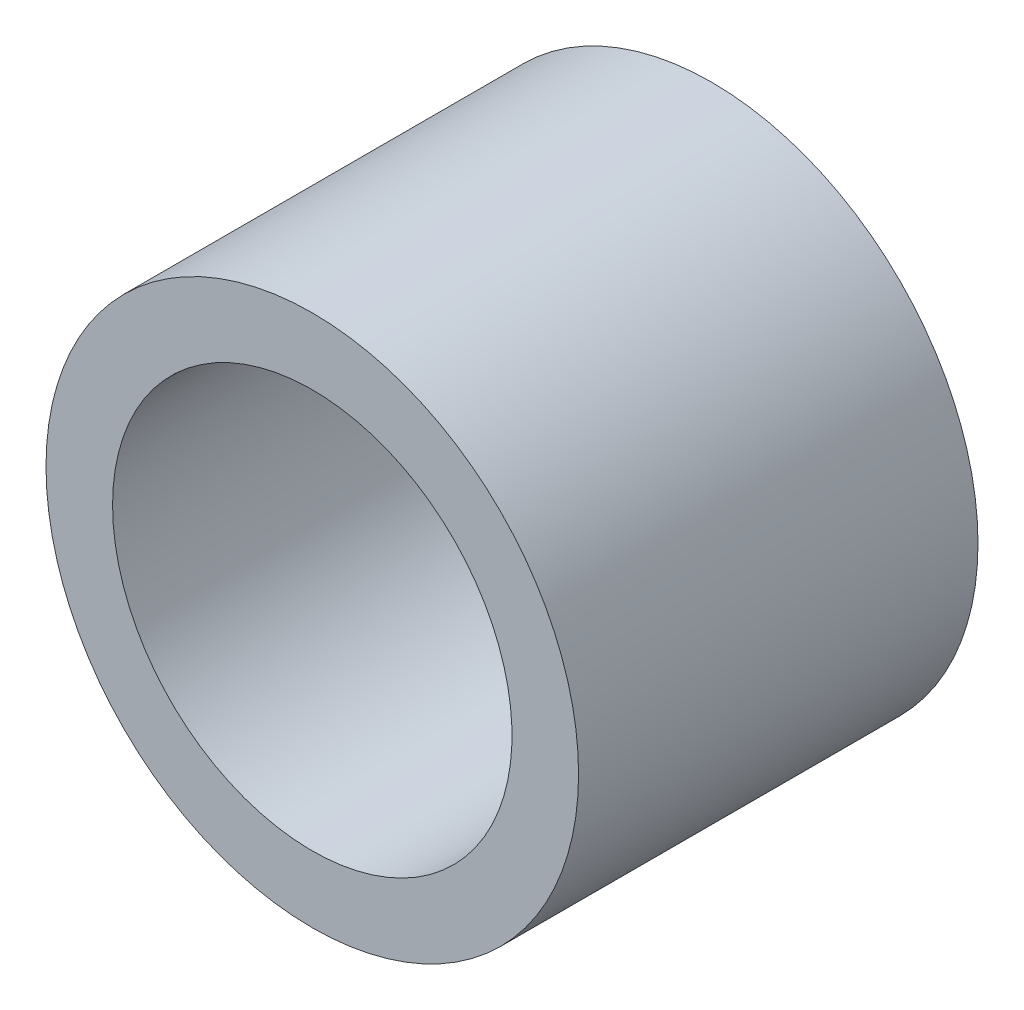
from build123d import *

# Parameters (mm, degrees)
SKETCH1_R           = 6.35
SKETCH1_R_2         = 4.7625
BOSS_EXTRUDE1_DEPTH = 9.525


with BuildPart() as part:
    # Sketch1 → Boss-Extrude1 (new body)
    with BuildSketch(Plane.XY):
        Circle(SKETCH1_R)
        Circle(SKETCH1_R_2, mode=Mode.SUBTRACT)
    extrude(amount=BOSS_EXTRUDE1_DEPTH)


solid = part.part
